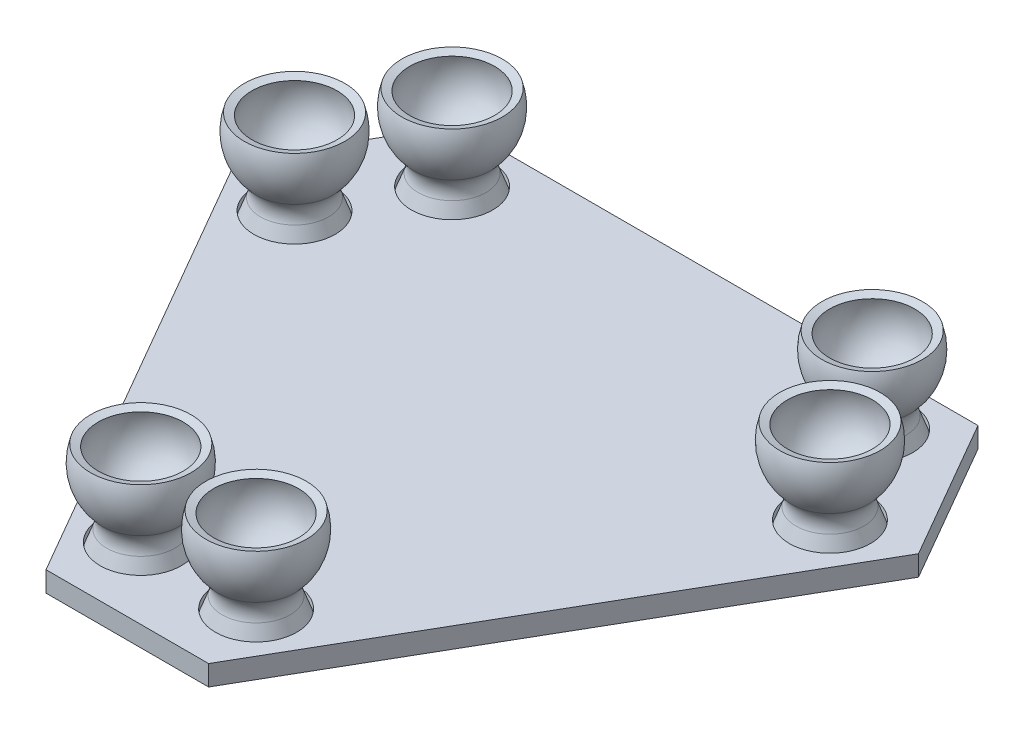
from build123d import *

# Parameters (mm, degrees)
BOSS_EXTRUDE1_DEPTH  = 5
CUT_EXTRUDE4_START   = 5
SKETCH1_5_R          = 10
CUT_EXTRUDE4_DEPTH   = 1.6
CIRPATTERN1_COUNT    = 3
SKETCH6_R            = 10
BOSS_EXTRUDE2_DEPTH  = 10
BOSS_EXTRUDE2_TAPER  = 20
FILLET1_R            = 5
FILLET1_OF_MIRROR1_R = 5


# Read off the part's stored shape, not the designer's step: CirPattern2
with BuildPart() as part:
    # Sketch1 → Boss-Extrude1 (new body)
    with BuildSketch(Plane(origin=(0, 0, 0), x_dir=(1, 0, 0), z_dir=(0, 1, 0))):
        Polygon((20, -85.358983849), (83.923048454, 25.358983849), (63.923048454, 60), (-63.923048454, 60), (-83.923048454, 25.358983849), (-20, -85.358983849), align=None)
    extrude(amount=BOSS_EXTRUDE1_DEPTH)

    # Sketch1<5> → Cut-Extrude4 (cut)
    with BuildSketch(Plane(origin=(0, 0, 0), x_dir=(1, 0, 0), z_dir=(0, 1, 0)).offset(CUT_EXTRUDE4_START)):
        with Locations(Location((-14.186994533, -67.858983849, 0), (0, 0, 270))):
            Circle(SKETCH1_5_R)
        with Locations(Location((14.186994533, -67.858983849, 0), (0, 0, 270))):
            Circle(SKETCH1_5_R)
    cut_extrude4 = extrude(amount=-CUT_EXTRUDE4_DEPTH, mode=Mode.SUBTRACT)

    # CirPattern1: Cut-Extrude4 ×3 about axis
    cirpattern1_axis = Axis((0, 0, 0), (0, 1, 0))
    for i in range(1, CIRPATTERN1_COUNT):
        add(cut_extrude4.rotate(cirpattern1_axis, i * 360 / CIRPATTERN1_COUNT), mode=Mode.SUBTRACT)



with BuildPart() as body_2:
    # Sketch5 → Revolve1 (revolve)
    with BuildSketch(Plane.YX.offset(-67.858983849), mode=Mode.PRIVATE) as revolve1_sk:
        with BuildLine():
            Line((11, 14.186994533), (9, 14.186994533))
            ThreePointArc((9, 14.186994533), (14.35147073, 24.698892554), (26, 26.55631141))
            Line((26, 26.55631141), (25.384615385, 24.653339583))
            ThreePointArc((25.384615385, 24.653339583), (15.52816754, 23.081677474), (11, 14.186994533))
        make_face()
    revolve1 = revolve(revolve1_sk.sketch.rotate(Axis((14.186994533, 5, 67.858983849), (0, 1, 0)), 90), axis=Axis((14.186994533, 5, 67.858983849), (0, 1, 0)))


with BuildPart() as part_1:
    add(part.part)

    add(body_2.part)  # Boss-Extrude2 merges body 2
    # Sketch6 → Boss-Extrude2 (add)
    with BuildSketch(Plane(origin=(0, 3.4, 0), x_dir=(1, 0, 0), z_dir=(0, 1, 0))):
        with Locations(Location((14.186994533, -67.858983849, 0), (0, 0, 270))):
            Circle(SKETCH6_R)
    boss_extrude2 = extrude(amount=BOSS_EXTRUDE2_DEPTH, taper=BOSS_EXTRUDE2_TAPER)

    # Fillet1
    fillet1_edges = [part_1.edges().sort_by_distance(p)[0] for p in [
        (21.362657137, 11.159803221, 67.858983849),
    ]]
    fillet(fillet1_edges, radius=FILLET1_R)

    # Mirror1: Revolve1, Boss-Extrude2 across plane
    add(revolve1.mirror(Plane(origin=(0, 0, 0), x_dir=(0, 0, 1), z_dir=(1, 0, 0))))
    add(boss_extrude2.mirror(Plane(origin=(0, 0, 0), x_dir=(0, 0, 1), z_dir=(1, 0, 0))))

    # Fillet1 of Mirror1
    fillet1_of_mirror1_edges = [part_1.edges().sort_by_distance(p)[0] for p in [
        (-21.362657137, 11.159803221, 67.858983849),
    ]]
    fillet(fillet1_of_mirror1_edges, radius=FILLET1_OF_MIRROR1_R)

    # CirPattern2 outline → CirPattern2 (revolve)
    with BuildSketch(Plane(origin=(51.674106621, 0, -46.215789594), x_dir=(1, 0, 0), z_dir=(0, 0, 1))):
        with BuildLine():
            Line((6.360297657, 13.4), (0, 13.4))
            Line((0, 13.4), (0, 3.4))
            Line((0, 3.4), (10, 3.4))
            Line((10, 3.4), (8.361191226, 7.902590101))
            ThreePointArc((8.361191226, 7.902590101), (8.164307186, 10.630323533), (9.431972572, 13.053610035))
            ThreePointArc((9.431972572, 13.053610035), (12.677788004, 19.123597505), (12.369316875, 26.000000006))
            Line((12.369316875, 26.000000006), (10.466345048, 25.38461539))
            ThreePointArc((10.466345048, 25.38461539), (10.459790386, 18.59518208), (6.468449114, 13.102856298))
            Line((6.468449114, 13.102856298), (6.360297657, 13.4))
        make_face()
    revolve(axis=Axis((51.674106621, 0, -46.215789594), (0, 1, 0)))

    # CirPattern2 2 outline → CirPattern2 2 (revolve)
    with BuildSketch(Plane(origin=(-65.861101155, 0, -21.643194255), x_dir=(1, 0, 0), z_dir=(0, 0, 1))):
        with BuildLine():
            Line((6.360297657, 13.4), (0, 13.4))
            Line((0, 13.4), (0, 3.4))
            Line((0, 3.4), (10, 3.4))
            Line((10, 3.4), (8.361191226, 7.902590101))
            ThreePointArc((8.361191226, 7.902590101), (8.164307186, 10.630323533), (9.431972572, 13.053610035))
            ThreePointArc((9.431972572, 13.053610035), (12.677788004, 19.123597505), (12.369316875, 26.000000006))
            Line((12.369316875, 26.000000006), (10.466345048, 25.38461539))
            ThreePointArc((10.466345048, 25.38461539), (10.459790386, 18.59518208), (6.468449114, 13.102856298))
            Line((6.468449114, 13.102856298), (6.360297657, 13.4))
        make_face()
    revolve(axis=Axis((-65.861101155, 0, -21.643194255), (0, 1, 0)))

    # CirPattern2 3 outline → CirPattern2 3 (revolve)
    with BuildSketch(Plane(origin=(65.861101155, 0, -21.643194255), x_dir=(1, 0, 0), z_dir=(0, 0, 1))):
        with BuildLine():
            Line((6.360297657, 13.4), (0, 13.4))
            Line((0, 13.4), (0, 3.4))
            Line((0, 3.4), (10, 3.4))
            Line((10, 3.4), (8.361191226, 7.902590101))
            ThreePointArc((8.361191226, 7.902590101), (8.164307186, 10.630323533), (9.431972572, 13.053610035))
            ThreePointArc((9.431972572, 13.053610035), (12.677788004, 19.123597505), (12.369316875, 26.000000006))
            Line((12.369316875, 26.000000006), (10.466345048, 25.38461539))
            ThreePointArc((10.466345048, 25.38461539), (10.459790386, 18.59518208), (6.468449114, 13.102856298))
            Line((6.468449114, 13.102856298), (6.360297657, 13.4))
        make_face()
    revolve(axis=Axis((65.861101155, 0, -21.643194255), (0, 1, 0)))

    # CirPattern2 4 outline → CirPattern2 4 (revolve)
    with BuildSketch(Plane(origin=(-51.674106621, 0, -46.215789594), x_dir=(1, 0, 0), z_dir=(0, 0, 1))):
        with BuildLine():
            Line((6.360297657, 13.4), (0, 13.4))
            Line((0, 13.4), (0, 3.4))
            Line((0, 3.4), (10, 3.4))
            Line((10, 3.4), (8.361191226, 7.902590101))
            ThreePointArc((8.361191226, 7.902590101), (8.164307186, 10.630323533), (9.431972572, 13.053610035))
            ThreePointArc((9.431972572, 13.053610035), (12.677788004, 19.123597505), (12.369316875, 26.000000006))
            Line((12.369316875, 26.000000006), (10.466345048, 25.38461539))
            ThreePointArc((10.466345048, 25.38461539), (10.459790386, 18.59518208), (6.468449114, 13.102856298))
            Line((6.468449114, 13.102856298), (6.360297657, 13.4))
        make_face()
    revolve(axis=Axis((-51.674106621, 0, -46.215789594), (0, 1, 0)))


solid = part_1.part
